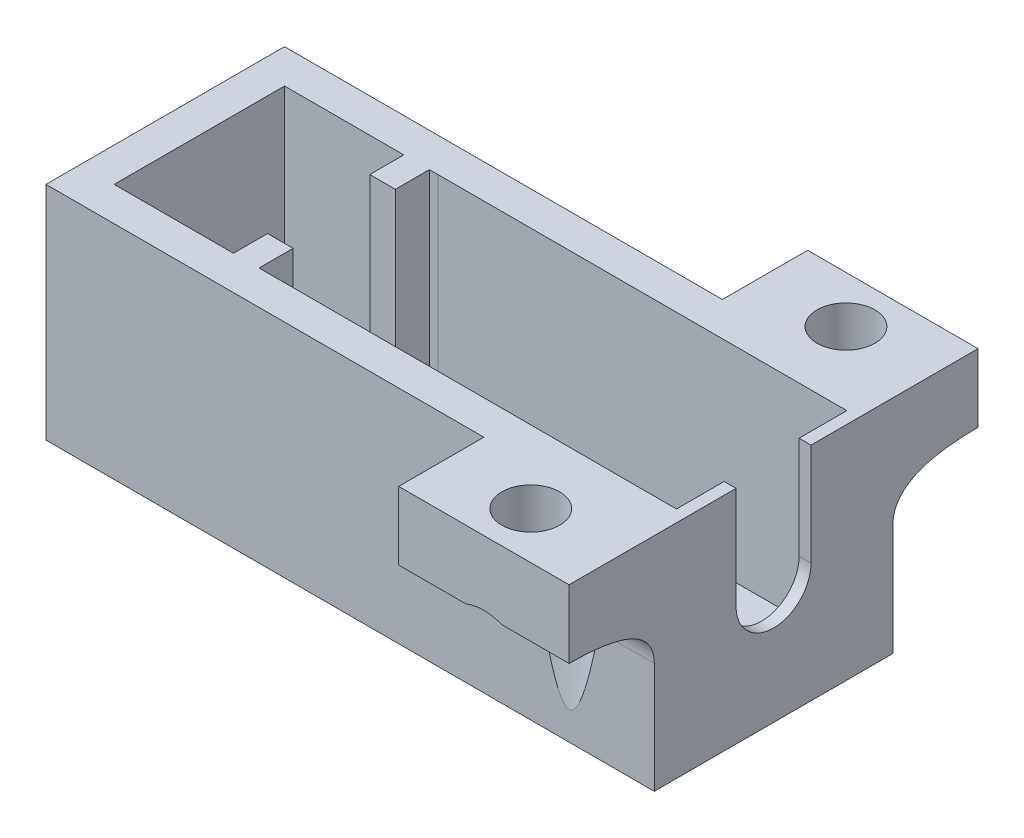
from build123d import *

# Parameters (mm, degrees)
SKETCH1_W                     = 25.7
SKETCH1_H                     = 16
BOSS_EXTRUDE5_DEPTH           = 13
SKETCH3_W                     = 24
SKETCH3_H                     = 10
CUT_EXTRUDE1_DEPTH            = 12
SKETCH6_W                     = 6
SKETCH6_H                     = 12
CUT_EXTRUDE6_DEPTH            = 12
SKETCH12_W                    = 25.7
SKETCH12_H                    = 13
CUT_EXTRUDE9_DEPTH            = 1
SKETCH13_W                    = 25.7
SKETCH13_H                    = 13
CUT_EXTRUDE10_DEPTH           = 1
SKETCH14_W                    = 25.7
SKETCH14_H                    = 0.24
CUT_EXTRUDE11_DEPTH           = 26.979383268
SKETCH15_W                    = 25.7
SKETCH15_H                    = 0.24
BOSS_EXTRUDE6_DEPTH           = 13
BOSS_EXTRUDE8_DEPTH           = 10
SKETCH22_W                    = 10
SKETCH22_H                    = 14
BOSS_EXTRUDE11_DEPTH          = 13
SKETCH25_W                    = 8
SKETCH25_H                    = 10
CUT_EXTRUDE17_DEPTH           = 12
SKETCH26_W                    = 1.5
SKETCH26_H                    = 2
BOSS_EXTRUDE12_DEPTH          = 13
SKETCH27_W                    = 0.5
SKETCH27_H                    = 1.76
CUT_EXTRUDE18_DEPTH           = 12
SKETCH28_W                    = 1.277363426
SKETCH28_H                    = 0.860849325
BOSS_EXTRUDE13_DEPTH          = 12
CUT_EXTRUDE20_DEPTH           = 12
CUT_EXTRUDE21_START           = -2.75
SKETCH39_R                    = 1.7
CUT_EXTRUDE21_DEPTH           = 1.5
CUT_EXTRUDE21_DRAFT           = 45
CUT_EXTRUDE21_PROFILE_2_DEPTH = 1.5
CUT_EXTRUDE21_PROFILE_2_DRAFT = 45
SKETCH39_4_R                  = 1.7
CUT_EXTRUDE22_DEPTH           = 5
CUT_EXTRUDE23_START           = -4
SKETCH39_5_R                  = 3.15
CUT_EXTRUDE23_DEPTH           = 10
CUT_EXTRUDE23_DRAFT           = -7
CUT_EXTRUDE23_PROFILE_2_DEPTH = 10
CUT_EXTRUDE23_PROFILE_2_DRAFT = -7


with BuildPart() as part:
    # Sketch1 → Boss-Extrude5 (new body)
    with BuildSketch(Plane(origin=(0, 0, 0), x_dir=(1, 0, 0), z_dir=(0, 1, 0))):
        with Locations((4.864219333, 6.861269364)):
            Rectangle(SKETCH1_W, SKETCH1_H)
    extrude(amount=BOSS_EXTRUDE5_DEPTH)

    # Sketch3 → Cut-Extrude1 (cut)
    with BuildSketch(Plane(origin=(0, 13, 0), x_dir=(1, 0, 0), z_dir=(0, 1, 0))):
        with Locations((5.015394501, 6.623768503)):
            Rectangle(SKETCH3_W, SKETCH3_H)
    extrude(amount=-CUT_EXTRUDE1_DEPTH, mode=Mode.SUBTRACT)

    # Sketch6 → Cut-Extrude6 (cut)
    with BuildSketch(Plane.ZY.offset(7.985780667)):
        with Locations((-6.861269364, 7)):
            Rectangle(SKETCH6_W, SKETCH6_H)
    extrude(amount=-CUT_EXTRUDE6_DEPTH, mode=Mode.SUBTRACT)

    # Sketch12 → Cut-Extrude9 (cut)
    with BuildSketch(Plane(origin=(0, 0, -14.861269364), x_dir=(-1, 0, 0), z_dir=(0, 0, -1))):
        with Locations((-4.864219333, 6.5)):
            Rectangle(SKETCH12_W, SKETCH12_H)
    extrude(amount=-CUT_EXTRUDE9_DEPTH, mode=Mode.SUBTRACT)

    # Sketch13 → Cut-Extrude10 (cut)
    with BuildSketch(Plane.XY.offset(1.138730636)):
        with Locations((4.864219333, 6.5)):
            Rectangle(SKETCH13_W, SKETCH13_H)
    extrude(amount=-CUT_EXTRUDE10_DEPTH, mode=Mode.SUBTRACT)

    # Sketch14 → Cut-Extrude11 (cut, through all)
    with BuildSketch(Plane(origin=(0, 13, 0), x_dir=(1, 0, 0), z_dir=(0, 1, 0))):
        with Locations((4.864219333, 13.741269364)):
            Rectangle(SKETCH14_W, SKETCH14_H)
    extrude(amount=-CUT_EXTRUDE11_DEPTH, mode=Mode.SUBTRACT)

    # Sketch15 → Boss-Extrude6 (add)
    with BuildSketch(Plane(origin=(0, 13, 0), x_dir=(1, 0, 0), z_dir=(0, 1, 0))):
        with Locations((4.864219333, -0.258730636)):
            Rectangle(SKETCH15_W, SKETCH15_H)
    extrude(amount=-BOSS_EXTRUDE6_DEPTH)

    # Sketch17 → Boss-Extrude8 (add)
    with BuildSketch(Plane(origin=(17.714219333, 0, 0), x_dir=(0, 0, -1), z_dir=(1, 0, 0))):
        with BuildLine():
            Line((13.621269364, 13), (18.621269364, 13))
            Line((18.621269364, 13), (18.621269364, 9))
            add(Edge.make_bspline(
                [(18.621269364, 9), (13.621269364, 9), (13.621269364, 6.5)],
                knots=[0, 0, 0, 1, 1, 1], degree=2))
            Line((13.621269364, 6.5), (13.621269364, 13))
        make_face()
        with BuildLine():
            Line((-0.378730636, 13), (-5.378730636, 13))
            Line((-5.378730636, 13), (-5.378730636, 9))
            add(Edge.make_bspline(
                [(-5.378730636, 9), (-0.378730636, 9), (-0.378730636, 6.5)],
                knots=[0, 0, 0, 1, 1, 1], degree=2))
            Line((-0.378730636, 6.5), (-0.378730636, 13))
        make_face()
    extrude(amount=-BOSS_EXTRUDE8_DEPTH)

    # Sketch22 → Boss-Extrude11 (add)
    with BuildSketch(Plane(origin=(0, 13, 0), x_dir=(1, 0, 0), z_dir=(0, 1, 0))):
        with Locations((-12.985780667, 6.621269364)):
            Rectangle(SKETCH22_W, SKETCH22_H)
    extrude(amount=-BOSS_EXTRUDE11_DEPTH)

    # Sketch25 → Cut-Extrude17 (cut)
    with BuildSketch(Plane(origin=(0, 13, 0), x_dir=(1, 0, 0), z_dir=(0, 1, 0))):
        with Locations((-11.985780667, 6.621269364)):
            Rectangle(SKETCH25_W, SKETCH25_H)
    extrude(amount=-CUT_EXTRUDE17_DEPTH, mode=Mode.SUBTRACT)

    # Sketch26 → Boss-Extrude12 (add)
    with BuildSketch(Plane(origin=(0, 13, 0), x_dir=(1, 0, 0), z_dir=(0, 1, 0))):
        with Locations((-8.234605499, 2.623768503)):
            Rectangle(SKETCH26_W, SKETCH26_H)
        with Locations((-8.234605499, 10.623768503)):
            Rectangle(SKETCH26_W, SKETCH26_H)
    extrude(amount=-BOSS_EXTRUDE12_DEPTH)

    # Sketch27 → Cut-Extrude18 (cut)
    with BuildSketch(Plane(origin=(0, 13, 0), x_dir=(1, 0, 0), z_dir=(0, 1, 0))):
        with Locations((-7.234605499, 10.741269364)):
            Rectangle(SKETCH27_W, SKETCH27_H)
        Polygon((-7.985780667, 3.861269364), (-7.985780667, 3.623768503), (-7.485193083, 3.623768503), (-7.485193083, 1.623768503), (-6.984605499, 1.623768503), (-6.984605499, 3.861269364), align=None)
    extrude(amount=-CUT_EXTRUDE18_DEPTH, mode=Mode.SUBTRACT)

    # Sketch28 → Boss-Extrude13 (add)
    with BuildSketch(Plane(origin=(0, 13, 0), x_dir=(1, 0, 0), z_dir=(0, 1, 0))):
        with Locations((-8.345923786, 1.388186548)):
            Rectangle(SKETCH28_W, SKETCH28_H)
    extrude(amount=-BOSS_EXTRUDE13_DEPTH)

    # Sketch35 → Cut-Extrude20 (cut)
    with BuildSketch(Plane(origin=(17.714219333, 0, 0), x_dir=(0, 0, -1), z_dir=(1, 0, 0))):
        with BuildLine():
            Line((4.421384975, 7), (4.421384975, 13))
            Line((4.421384975, 13), (8.821153753, 13))
            Line((8.821153753, 13), (8.821153753, 7))
            ThreePointArc((8.821153753, 7), (6.621269364, 4.800115611), (4.421384975, 7))
        make_face()
    extrude(amount=-CUT_EXTRUDE20_DEPTH, mode=Mode.SUBTRACT)


with BuildPart() as cut_extrude21_tool:
    # Sketch39 → Cut-Extrude21 (with draft: the straight prism first)
    with BuildSketch(Plane(origin=(0, 13, 0), x_dir=(1, 0, 0), z_dir=(0, 1, 0)).offset(CUT_EXTRUDE21_START)):
        with Locations((12.714219333, 15.871269364)):
            Circle(SKETCH39_R)
    extrude(amount=-CUT_EXTRUDE21_DEPTH)
    # Cut-Extrude21: the draft: its side faces are tilted about the plane it starts from
    cut_extrude21_sides = [cut_extrude21_tool.faces().sort_by_distance(p)[0] for p in [
        (11.014219333, 9.5, -15.871269364),
    ]]
    draft(cut_extrude21_sides, Plane(origin=(0, 13, 0), x_dir=(1, 0, 0), z_dir=(0, 1, 0)).offset(CUT_EXTRUDE21_START), CUT_EXTRUDE21_DRAFT)


with BuildPart() as part_1:
    add(part.part)

    # Cut-Extrude21: cut by cut_extrude21_tool
    add(cut_extrude21_tool.part, mode=Mode.SUBTRACT)


with BuildPart() as cut_extrude21_profile_2_tool:
    # Sketch39 → Cut-Extrude21 profile 2 (with draft: the straight prism first)
    with BuildSketch(Plane(origin=(0, 13, 0), x_dir=(1, 0, 0), z_dir=(0, 1, 0)).offset(CUT_EXTRUDE21_START)):
        with Locations((12.714219333, -2.628730636)):
            Circle(SKETCH39_R)
    extrude(amount=-CUT_EXTRUDE21_PROFILE_2_DEPTH)
    # Cut-Extrude21 profile 2: the draft: its side faces are tilted about the plane it starts from
    cut_extrude21_profile_2_sides = [cut_extrude21_profile_2_tool.faces().sort_by_distance(p)[0] for p in [
        (11.014219333, 9.5, 2.628730636),
    ]]
    draft(cut_extrude21_profile_2_sides, Plane(origin=(0, 13, 0), x_dir=(1, 0, 0), z_dir=(0, 1, 0)).offset(CUT_EXTRUDE21_START), CUT_EXTRUDE21_PROFILE_2_DRAFT)


with BuildPart() as part_2:
    add(part_1.part)

    # Cut-Extrude21 profile 2: cut by cut_extrude21_profile_2_tool
    add(cut_extrude21_profile_2_tool.part, mode=Mode.SUBTRACT)

    # Sketch39<4> → Cut-Extrude22 (cut)
    with BuildSketch(Plane(origin=(0, 13, 0), x_dir=(1, 0, 0), z_dir=(0, 1, 0))):
        with Locations((12.714219333, 15.871269364)):
            Circle(SKETCH39_4_R)
        with Locations((12.714219333, -2.628730636)):
            Circle(SKETCH39_4_R)
    extrude(amount=-CUT_EXTRUDE22_DEPTH, mode=Mode.SUBTRACT)


with BuildPart() as cut_extrude23_tool:
    # Sketch39<5> → Cut-Extrude23 (with draft: the straight prism first)
    with BuildSketch(Plane(origin=(0, 13, 0), x_dir=(1, 0, 0), z_dir=(0, 1, 0)).offset(CUT_EXTRUDE23_START)):
        with Locations((12.714219333, 15.871269364)):
            Circle(SKETCH39_5_R)
    extrude(amount=-CUT_EXTRUDE23_DEPTH)
    # Cut-Extrude23: the draft: its side faces are tilted about the plane it starts from
    cut_extrude23_sides = [cut_extrude23_tool.faces().sort_by_distance(p)[0] for p in [
        (9.564219333, 4, -15.871269364),
    ]]
    draft(cut_extrude23_sides, Plane(origin=(0, 13, 0), x_dir=(1, 0, 0), z_dir=(0, 1, 0)).offset(CUT_EXTRUDE23_START), CUT_EXTRUDE23_DRAFT)


with BuildPart() as part_3:
    add(part_2.part)

    # Cut-Extrude23: cut by cut_extrude23_tool
    add(cut_extrude23_tool.part, mode=Mode.SUBTRACT)


with BuildPart() as cut_extrude23_profile_2_tool:
    # Sketch39<5> → Cut-Extrude23 profile 2 (with draft: the straight prism first)
    with BuildSketch(Plane(origin=(0, 13, 0), x_dir=(1, 0, 0), z_dir=(0, 1, 0)).offset(CUT_EXTRUDE23_START)):
        with Locations((12.714219333, -2.628730636)):
            Circle(SKETCH39_5_R)
    extrude(amount=-CUT_EXTRUDE23_PROFILE_2_DEPTH)
    # Cut-Extrude23 profile 2: the draft: its side faces are tilted about the plane it starts from
    cut_extrude23_profile_2_sides = [cut_extrude23_profile_2_tool.faces().sort_by_distance(p)[0] for p in [
        (9.564219333, 4, 2.628730636),
    ]]
    draft(cut_extrude23_profile_2_sides, Plane(origin=(0, 13, 0), x_dir=(1, 0, 0), z_dir=(0, 1, 0)).offset(CUT_EXTRUDE23_START), CUT_EXTRUDE23_PROFILE_2_DRAFT)


with BuildPart() as part_4:
    add(part_3.part)

    # Cut-Extrude23 profile 2: cut by cut_extrude23_profile_2_tool
    add(cut_extrude23_profile_2_tool.part, mode=Mode.SUBTRACT)


solid = part_4.part
